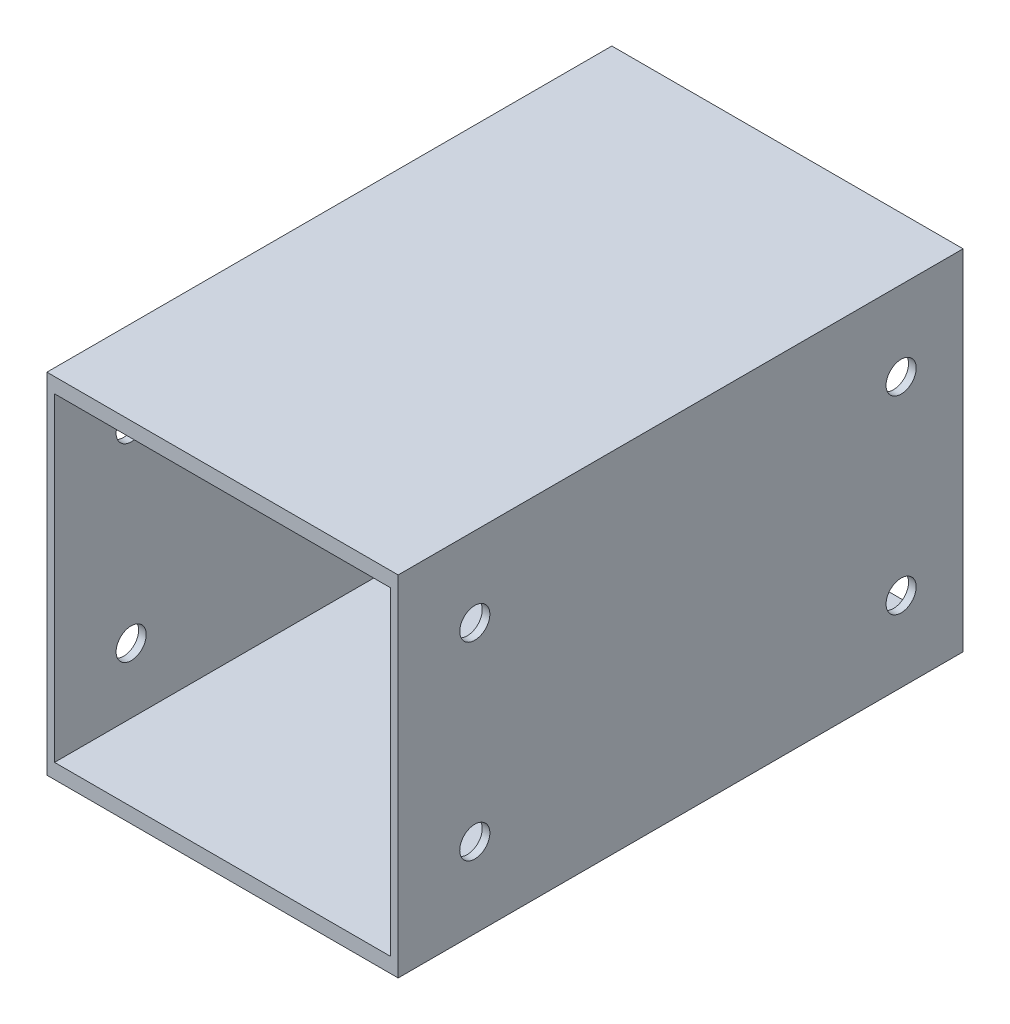
from build123d import *

# Parameters (mm, degrees)
CROQUIS1_W              = 47.0868375
CROQUIS1_H              = 46.794250074
CROQUIS1_W_2            = 45.0453125
CROQUIS1_H_2            = 42.793750074
SALIENTE_EXTRUIR1_DEPTH = 75.731700962
CROQUIS2_R              = 2.0193
CORTAR_EXTRUIR1_DEPTH   = 93.194827709


with BuildPart() as part:
    # Croquis1 → Saliente-Extruir1 (new body)
    with BuildSketch(Plane.XY):
        Rectangle(CROQUIS1_W, CROQUIS1_H)
        Rectangle(CROQUIS1_W_2, CROQUIS1_H_2, mode=Mode.SUBTRACT)
    extrude(amount=SALIENTE_EXTRUIR1_DEPTH)

    # Croquis2 → Cortar-Extruir1 (cut, through all)
    with BuildSketch(Plane(origin=(-23.54341875, 0, 0), x_dir=(0, 1, 0), z_dir=(-1, 0, 0))):
        with Locations((12.699999873, -65.456700938)):
            Circle(CROQUIS2_R)
        with Locations((-12.699999873, -65.456700938)):
            Circle(CROQUIS2_R)
        with Locations((-12.699999873, -8.306700938)):
            Circle(CROQUIS2_R)
        with Locations((12.699999873, -8.306700938)):
            Circle(CROQUIS2_R)
    extrude(amount=-CORTAR_EXTRUIR1_DEPTH, mode=Mode.SUBTRACT)


solid = part.part
